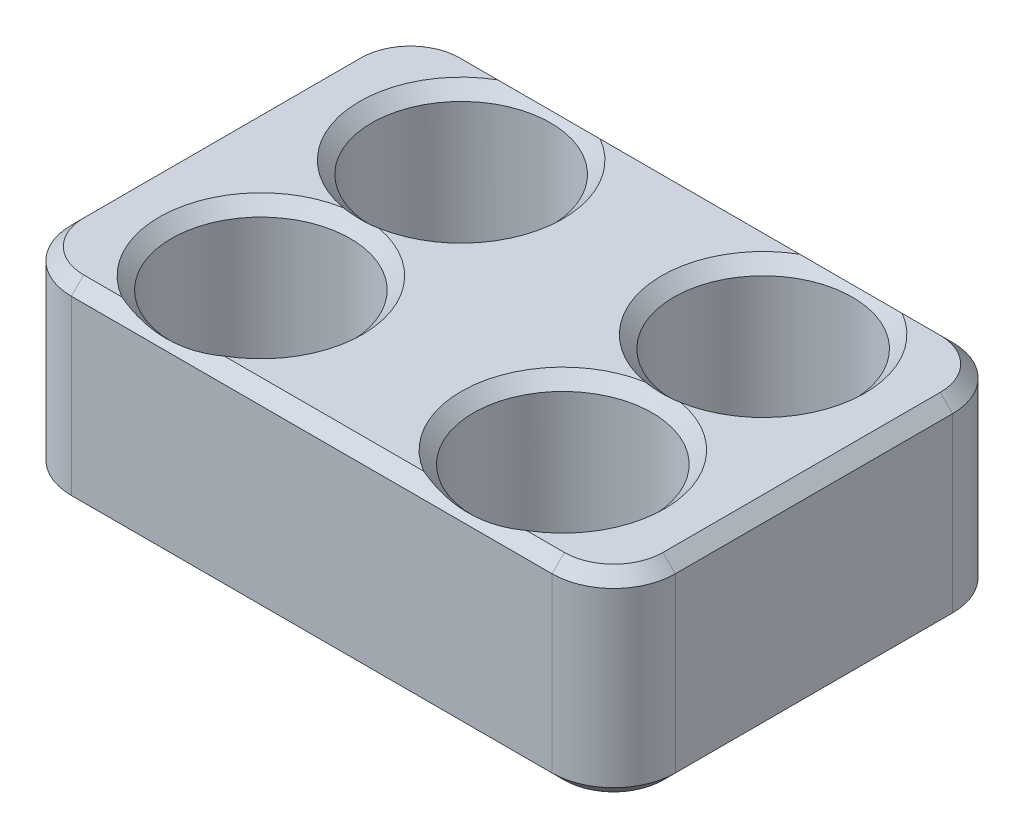
from build123d import *

# Parameters (mm, degrees)
SKETCH1_W           = 98
SKETCH1_H           = 65
BOSS_EXTRUDE1_DEPTH = 32
SKETCH2_R           = 14.5
CUT_EXTRUDE1_DEPTH  = 27
FILLET1_R           = 10
FILLET2_R           = 10
FILLET3_R           = 10
FILLET4_R           = 10
CHAMFER1_SIZE       = 2
CUT_EXTRUDE2_START  = -0.5
SKETCH3_W           = 60
SKETCH3_H           = 10
CUT_EXTRUDE2_DEPTH  = 3


with BuildPart() as part:
    # Sketch1 → Boss-Extrude1 (new body)
    with BuildSketch(Plane(origin=(0, 0, 0), x_dir=(1, 0, 0), z_dir=(0, 1, 0))):
        with Locations((-41, -4.919354839)):
            Rectangle(SKETCH1_W, SKETCH1_H)
    extrude(amount=BOSS_EXTRUDE1_DEPTH)

    # Sketch2 → Cut-Extrude1 (cut)
    with BuildSketch(Plane(origin=(0, 32, 0), x_dir=(1, 0, 0), z_dir=(0, 1, 0))):
        with Locations(Location((-16.5, 11.330645161, 0), (0, 0, 270))):
            Circle(SKETCH2_R)
        with Locations(Location((-16.5, -21.169354839, 0), (0, 0, 90))):
            Circle(SKETCH2_R)
        with Locations(Location((-65.5, 11.330645161, 0), (0, 0, 90))):
            Circle(SKETCH2_R)
        with Locations(Location((-65.5, -21.169354839, 0), (0, 0, 270))):
            Circle(SKETCH2_R)
    extrude(amount=-CUT_EXTRUDE1_DEPTH, mode=Mode.SUBTRACT)

    # Fillet1
    fillet1_edges = [part.edges().sort_by_distance(p)[0] for p in [
        (8, 16, -27.580645161),
    ]]
    fillet(fillet1_edges, radius=FILLET1_R)

    # Fillet2
    fillet2_edges = [part.edges().sort_by_distance(p)[0] for p in [
        (-90, 16, 37.419354839),
    ]]
    fillet(fillet2_edges, radius=FILLET2_R)

    # Fillet3
    fillet3_edges = [part.edges().sort_by_distance(p)[0] for p in [
        (-90, 16, -27.580645161),
    ]]
    fillet(fillet3_edges, radius=FILLET3_R)

    # Fillet4
    fillet4_edges = [part.edges().sort_by_distance(p)[0] for p in [
        (8, 16, 37.419354839),
    ]]
    fillet(fillet4_edges, radius=FILLET4_R)

    # Chamfer1
    # the kernel refuses this chamfer: 2 mm, written as the material it adds along each edge
    with BuildSketch(Plane(origin=(-16.5, 5, 21.169354839), x_dir=(0, 0, -1), z_dir=(1, 0, 0))) as chamfer1_piece_1:
        Polygon((14.5, CHAMFER1_SIZE), (14.5 - CHAMFER1_SIZE, 0), (14.5, 0), align=None)
    revolve(axis=Axis((-16.5, 5, 21.169354839), (0, 1, 0)))
    with BuildSketch(Plane(origin=(-65.5, 5, -11.330645161), x_dir=(0, 0, -1), z_dir=(1, 0, 0))) as chamfer1_piece_2:
        Polygon((14.5, CHAMFER1_SIZE), (14.5 - CHAMFER1_SIZE, 0), (14.5, 0), align=None)
    revolve(axis=Axis((-65.5, 5, -11.330645161), (0, 1, 0)))
    with BuildSketch(Plane(origin=(-65.5, 5, 21.169354839), x_dir=(0, 0, 1), z_dir=(-1, 0, 0))) as chamfer1_piece_3:
        Polygon((14.5, CHAMFER1_SIZE), (14.5 - CHAMFER1_SIZE, 0), (14.5, 0), align=None)
    revolve(axis=Axis((-65.5, 5, 21.169354839), (0, 1, 0)))
    with BuildSketch(Plane(origin=(-16.5, 5, -11.330645161), x_dir=(0, 0, 1), z_dir=(-1, 0, 0))) as chamfer1_piece_4:
        Polygon((14.5, CHAMFER1_SIZE), (14.5 - CHAMFER1_SIZE, 0), (14.5, 0), align=None)
    revolve(axis=Axis((-16.5, 5, -11.330645161), (0, 1, 0)))
    # the kernel refuses this chamfer: 2 mm, written as the material it takes off along each edge
    with BuildSketch(Plane(origin=(-16.5, 32, 21.169354839), x_dir=(0, 0, -1), z_dir=(1, 0, 0))) as chamfer1_2_piece_1:
        Polygon((14.5 + CHAMFER1_SIZE, 0), (14.5, -CHAMFER1_SIZE), (14.5, 0), align=None)
    revolve(axis=Axis((-16.5, 32, 21.169354839), (0, 1, 0)), mode=Mode.SUBTRACT)
    with BuildSketch(Plane(origin=(-65.5, 32, -11.330645161), x_dir=(0, 0, -1), z_dir=(1, 0, 0))) as chamfer1_2_piece_2:
        Polygon((14.5 + CHAMFER1_SIZE, 0), (14.5, -CHAMFER1_SIZE), (14.5, 0), align=None)
    revolve(axis=Axis((-65.5, 32, -11.330645161), (0, 1, 0)), mode=Mode.SUBTRACT)
    with BuildSketch(Plane(origin=(-65.5, 32, 21.169354839), x_dir=(0, 0, 1), z_dir=(-1, 0, 0))) as chamfer1_2_piece_3:
        Polygon((14.5 + CHAMFER1_SIZE, 0), (14.5, -CHAMFER1_SIZE), (14.5, 0), align=None)
    revolve(axis=Axis((-65.5, 32, 21.169354839), (0, 1, 0)), mode=Mode.SUBTRACT)
    with BuildSketch(Plane(origin=(-16.5, 32, -11.330645161), x_dir=(0, 0, 1), z_dir=(-1, 0, 0))) as chamfer1_2_piece_4:
        Polygon((14.5 + CHAMFER1_SIZE, 0), (14.5, -CHAMFER1_SIZE), (14.5, 0), align=None)
    revolve(axis=Axis((-16.5, 32, -11.330645161), (0, 1, 0)), mode=Mode.SUBTRACT)
    with BuildSketch(Plane(origin=(-80, 0, -27.580645161), x_dir=(0, -0.02749587661058639, 0.9996219169112968), z_dir=(1, 0, 0)), Plane(origin=(-80, 32, -27.580645161), x_dir=(0, -0.9996219169112968, -0.027495876610585647), z_dir=(1, 0, 0)), Plane(origin=(-2, 0, 37.419354839), x_dir=(0, -0.02749587661058639, -0.9996219169112968), z_dir=(-1, 0, 0)), Plane(origin=(-2, 32, 37.419354839), x_dir=(0, -0.9996219169112968, 0.027495876610585647), z_dir=(-1, 0, 0))) as chamfer1_2_piece_5:
        Polygon((CHAMFER1_SIZE * 0.999621916911, -CHAMFER1_SIZE * 0.0274958766106), (-CHAMFER1_SIZE * 0.0274958766106, -CHAMFER1_SIZE * 0.999621916911), (0, 0), align=None)
    extrude(amount=78, mode=Mode.SUBTRACT)
    with BuildSketch(Plane(origin=(-2, 0, -17.580645161), x_dir=(0, 0, -1), z_dir=(-1, 0, 0))) as chamfer1_2_piece_6:
        Polygon((10 - CHAMFER1_SIZE, 0), (10, -CHAMFER1_SIZE), (10, 0), align=None)
    revolve(axis=Axis((-2, 0, -17.580645161), (0, -1, 0)), revolution_arc=90, mode=Mode.SUBTRACT)
    with BuildSketch(Plane(origin=(-2, 32, -17.580645161), x_dir=(0, 0, -1), z_dir=(-1, 0, 0))) as chamfer1_2_piece_7:
        Polygon((10, CHAMFER1_SIZE), (10 - CHAMFER1_SIZE, 0), (10, 0), align=None)
    revolve(axis=Axis((-2, 32, -17.580645161), (0, -1, 0)), revolution_arc=90, mode=Mode.SUBTRACT)
    with BuildSketch(Plane(origin=(-80, 32, 27.419354839), x_dir=(-1, 0, 0), z_dir=(0, 0, -1))) as chamfer1_2_piece_8:
        Polygon((10, -CHAMFER1_SIZE), (10 - CHAMFER1_SIZE, 0), (10, 0), align=None)
    revolve(axis=Axis((-80, 32, 27.419354839), (0, 1, 0)), revolution_arc=90, mode=Mode.SUBTRACT)
    with BuildSketch(Plane(origin=(-80, 0, 27.419354839), x_dir=(-1, 0, 0), z_dir=(0, 0, -1))) as chamfer1_2_piece_9:
        Polygon((10 - CHAMFER1_SIZE, 0), (10, CHAMFER1_SIZE), (10, 0), align=None)
    revolve(axis=Axis((-80, 0, 27.419354839), (0, 1, 0)), revolution_arc=90, mode=Mode.SUBTRACT)
    with BuildSketch(Plane(origin=(-90, 0, 27.419354839), x_dir=(0.9996219169112968, -0.027495876610586292, 0), z_dir=(0, 0, -1)), Plane(origin=(-90, 32, 27.419354839), x_dir=(-0.0274958766105891, -0.9996219169112968, 0), z_dir=(0, 0, -1)), Plane(origin=(8, 0, -17.580645161), x_dir=(-0.9996219169112968, -0.027495876610586438, 0), z_dir=(0, 0, 1)), Plane(origin=(8, 32, -17.580645161), x_dir=(0.02749587661058651, -0.9996219169112968, 0), z_dir=(0, 0, 1))) as chamfer1_2_piece_10:
        Polygon((CHAMFER1_SIZE * 0.999621916911, -CHAMFER1_SIZE * 0.0274958766106), (-CHAMFER1_SIZE * 0.0274958766106, -CHAMFER1_SIZE * 0.999621916911), (0, 0), align=None)
    extrude(amount=45, mode=Mode.SUBTRACT)
    with BuildSketch(Plane(origin=(-80, 0, -17.580645161), x_dir=(-1, 0, 0), z_dir=(0, 0, 1))) as chamfer1_2_piece_11:
        Polygon((10 - CHAMFER1_SIZE, 0), (10, -CHAMFER1_SIZE), (10, 0), align=None)
    revolve(axis=Axis((-80, 0, -17.580645161), (0, -1, 0)), revolution_arc=90, mode=Mode.SUBTRACT)
    with BuildSketch(Plane(origin=(-80, 32, -17.580645161), x_dir=(-1, 0, 0), z_dir=(0, 0, 1))) as chamfer1_2_piece_12:
        Polygon((10, CHAMFER1_SIZE), (10 - CHAMFER1_SIZE, 0), (10, 0), align=None)
    revolve(axis=Axis((-80, 32, -17.580645161), (0, -1, 0)), revolution_arc=90, mode=Mode.SUBTRACT)
    with BuildSketch(Plane(origin=(-2, 32, 27.419354839), x_dir=(0, 0, 1), z_dir=(-1, 0, 0))) as chamfer1_2_piece_13:
        Polygon((10, -CHAMFER1_SIZE), (10 - CHAMFER1_SIZE, 0), (10, 0), align=None)
    revolve(axis=Axis((-2, 32, 27.419354839), (0, 1, 0)), revolution_arc=90, mode=Mode.SUBTRACT)
    with BuildSketch(Plane(origin=(-2, 0, 27.419354839), x_dir=(0, 0, 1), z_dir=(-1, 0, 0))) as chamfer1_2_piece_14:
        Polygon((10 - CHAMFER1_SIZE, 0), (10, CHAMFER1_SIZE), (10, 0), align=None)
    revolve(axis=Axis((-2, 0, 27.419354839), (0, 1, 0)), revolution_arc=90, mode=Mode.SUBTRACT)

    # Sketch3 → Cut-Extrude2 (cut)
    with BuildSketch(Plane.XZ.offset(CUT_EXTRUDE2_START)):
        with Locations((-41, 4.919354839)):
            Rectangle(SKETCH3_W, SKETCH3_H)
    extrude(amount=-CUT_EXTRUDE2_DEPTH, mode=Mode.SUBTRACT)


solid = part.part
